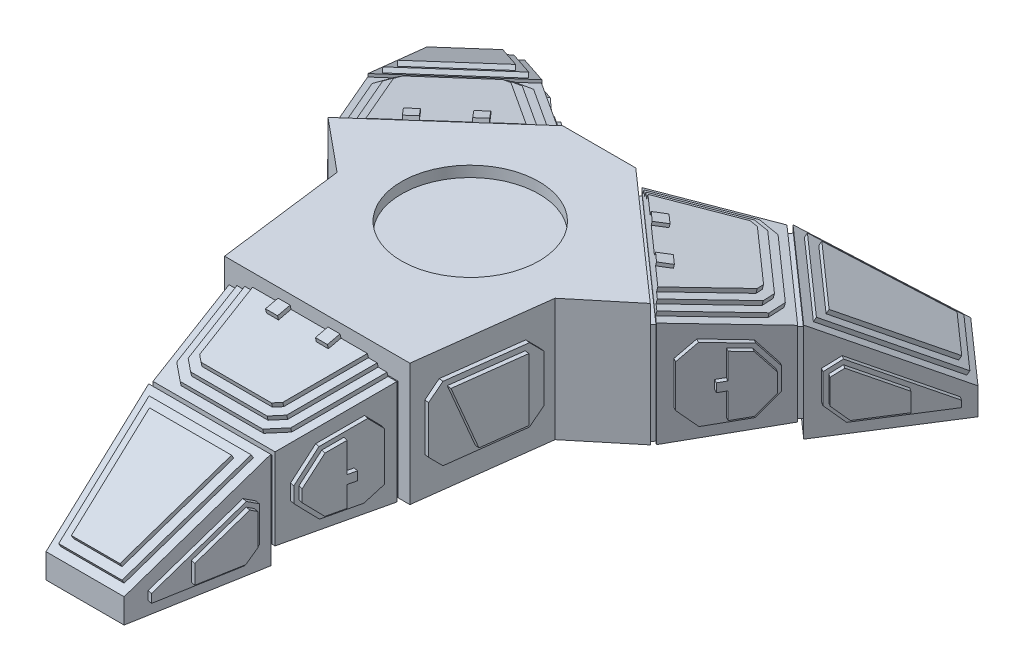
from build123d import *

# Parameters (mm, degrees)
BOSS_EXTRUDE1_DEPTH  = 14.25
SKETCH2_W            = 9.869565192
SKETCH2_H            = 12.25
BOSS_EXTRUDE2_DEPTH  = 12
DRAFT1_ANGLE         = 13
SKETCH3_W            = 6.724702797
SKETCH3_H            = 8.979581706
BOSS_EXTRUDE3_DEPTH  = 0.5
SKETCH4_W            = 7.099146898
SKETCH4_H            = 11.229581706
BOSS_EXTRUDE4_DEPTH  = 14.5
DRAFT2_ANGLE         = -30
DRAFT3_ANGLE         = -10
SKETCH5_W            = 0.5
SKETCH5_H            = 0.5
CUT_EXTRUDE1_DEPTH   = 42.024977271
SKETCH6_W            = 0.5
SKETCH6_H            = 0.5
CUT_EXTRUDE2_DEPTH   = 41.374636347
SKETCH7_W            = 18.337726852
SKETCH7_H            = 11.75
BOSS_EXTRUDE5_DEPTH  = 0.5
SKETCH8_W            = 19.337726852
SKETCH8_H            = 12.25
BOSS_EXTRUDE6_DEPTH  = 11.8
DRAFT4_ANGLE         = -12
SKETCH9_W            = 13.321391997
SKETCH9_H            = 9.241832572
BOSS_EXTRUDE7_DEPTH  = 0.5
SKETCH10_W           = 14.321391997
SKETCH10_H           = 11.491832572
BOSS_EXTRUDE8_DEPTH  = 14.5
DRAFT5_ANGLE         = -30
DRAFT6_ANGLE         = -9
SIDEDETAILS_DEPTH    = 0.5
BOSS_EXTRUDE10_DEPTH = 0.5
BOSS_EXTRUDE11_DEPTH = 0.5
BOSS_EXTRUDE12_DEPTH = 0.5
BOSS_EXTRUDE13_DEPTH = 0.5
BOSS_EXTRUDE14_DEPTH = 0.5
BOSS_EXTRUDE19_DEPTH = 0.5
BOSS_EXTRUDE20_DEPTH = 0.5
BOSS_EXTRUDE21_DEPTH = 0.5
BOSS_EXTRUDE22_DEPTH = 0.5
TOPDETAILS_DEPTH     = 0.5
BOSS_EXTRUDE24_DEPTH = 0.5
BOSS_EXTRUDE25_DEPTH = 0.5
BOSS_EXTRUDE26_DEPTH = 0.5
BOSS_EXTRUDE27_DEPTH = 0.5
BOSS_EXTRUDE28_DEPTH = 0.5
BOSS_EXTRUDE29_DEPTH = 0.4
BOSS_EXTRUDE30_DEPTH = 0.5
BOSS_EXTRUDE31_DEPTH = 0.5
SKETCH40_W           = 1.4
SKETCH40_H           = 1.5
BOSS_EXTRUDE32_DEPTH = 0.5
BOSS_EXTRUDE33_DEPTH = 0.5
BOSS_EXTRUDE34_DEPTH = 0.5
SKETCH46_R           = 8
CUT_EXTRUDE4_DEPTH   = 1.25
BOSS_EXTRUDE36_DEPTH = 0.5
BOSS_EXTRUDE37_DEPTH = 0.5


# Read off the part's stored shape, not the designer's step: Mirror1
with BuildPart() as part:
    # Sketch1 → Boss-Extrude1 (new body)
    with BuildSketch(Plane(origin=(0, 0, 0), x_dir=(1, 0, 0), z_dir=(0, 1, 0))):
        Polygon((0, 0), (10.776618207, 0), (12.678283248, 14.989595033), (18.740564562, 19.994875304), (4.25, 32.8), (0, 32.8), align=None)
    extrude(amount=BOSS_EXTRUDE1_DEPTH)

    # Sketch2 → Boss-Extrude2 (add)
    with BuildSketch(Plane.XY):
        with Locations((4.934782596, 6.125)):
            Rectangle(SKETCH2_W, SKETCH2_H)
    extrude(amount=BOSS_EXTRUDE2_DEPTH)

    # Draft1
    draft1_faces = [part.faces().sort_by_distance(p)[0] for p in [
        (9.869565192, 6.125, 6),
        (4.934782596, 12.25, 6),
    ]]
    draft(draft1_faces, Plane(origin=(0, 14.25, 0), x_dir=(1, 0, 0), z_dir=(0, 0, 1)), DRAFT1_ANGLE)

    # Sketch3 → Boss-Extrude3 (add)
    with BuildSketch(Plane.XY.offset(12)):
        with Locations((3.362351399, 4.489790853)):
            Rectangle(SKETCH3_W, SKETCH3_H)
    extrude(amount=BOSS_EXTRUDE3_DEPTH)

    # Sketch4 → Boss-Extrude4 (add)
    with BuildSketch(Plane.XY.offset(12.5)):
        with Locations((3.549573449, 3.864790853)):
            Rectangle(SKETCH4_W, SKETCH4_H)
    extrude(amount=BOSS_EXTRUDE4_DEPTH)

    # Draft2
    draft2_faces = [part.faces().sort_by_distance(p)[0] for p in [
        (3.549573449, 9.479581706, 19.75),
    ]]
    draft(draft2_faces, Plane(origin=(0, 0, 12.5), x_dir=(-1, 0, 0), z_dir=(0, 0, -1)), DRAFT2_ANGLE)

    # Draft3
    draft3_faces = [part.faces().sort_by_distance(p)[0] for p in [
        (7.099146898, 2.186465266, 18.313890377),
    ]]
    draft(draft3_faces, Plane(origin=(0, 0, 12.5), x_dir=(-1, 0, 0), z_dir=(0, 0, -1)), DRAFT3_ANGLE)

    # Sketch5 → Cut-Extrude1 (cut, through all)
    with BuildSketch(Plane(origin=(0, 14.25, 0), x_dir=(1, 0, 0), z_dir=(0, 1, 0))):
        with Locations((9.619565192, -0.25)):
            Rectangle(SKETCH5_W, SKETCH5_H)
    extrude(amount=-CUT_EXTRUDE1_DEPTH, mode=Mode.SUBTRACT)

    # Sketch6 → Cut-Extrude2 (cut, through all)
    with BuildSketch(Plane.ZY):
        with Locations((0.25, 12)):
            Rectangle(SKETCH6_W, SKETCH6_H)
    extrude(amount=-CUT_EXTRUDE2_DEPTH, mode=Mode.SUBTRACT)

    # Sketch7 → Boss-Extrude5 (add)
    with BuildSketch(Plane(origin=(18.138986789, 0, -20.526481811), x_dir=(-0.7493416714874174, 0, -0.6621835541392156), z_dir=(0.6621835541392156, 0, -0.7493416714874174))):
        with Locations((8.866055046, 5.875)):
            Rectangle(SKETCH7_W, SKETCH7_H)
    extrude(amount=BOSS_EXTRUDE5_DEPTH)

    # Sketch8 → Boss-Extrude6 (add)
    with BuildSketch(Plane(origin=(18.470078566, 0, -20.901152646), x_dir=(-0.7493416714874174, 0, -0.6621835541392156), z_dir=(0.6621835541392156, 0, -0.7493416714874174))):
        with Locations((8.866055046, 6.125)):
            Rectangle(SKETCH8_W, SKETCH8_H)
    extrude(amount=BOSS_EXTRUDE6_DEPTH)

    # Draft4
    draft4_faces = [part.faces().sort_by_distance(p)[0] for p in [
        (8.487974746, 6.125, -37.595786698),
        (15.733257028, 12.25, -31.19322435),
        (22.978539309, 6.125, -24.790662001),
    ]]
    draft(draft4_faces, Plane(origin=(18.470078566, 0, -20.901152646), x_dir=(0.7493416714874174, 0, 0.6621835541392156), z_dir=(-0.6621835541392156, 0, 0.7493416714874174)), DRAFT4_ANGLE)

    # Sketch9 → Boss-Extrude7 (add)
    with BuildSketch(Plane(origin=(26.283844505, 0, -29.74338437), x_dir=(-0.7493416714874174, 0, -0.6621835541392157), z_dir=(0.6621835541392157, 0, -0.7493416714874174))):
        with Locations((8.866055046, 4.620916286)):
            Rectangle(SKETCH9_W, SKETCH9_H)
    extrude(amount=BOSS_EXTRUDE7_DEPTH)

    # Sketch10 → Boss-Extrude8 (add)
    with BuildSketch(Plane(origin=(26.614936282, 0, -30.118055206), x_dir=(-0.7493416714874173, 0, -0.6621835541392158), z_dir=(0.6621835541392158, 0, -0.7493416714874173))):
        with Locations((8.866055046, 3.995916286)):
            Rectangle(SKETCH10_W, SKETCH10_H)
    extrude(amount=BOSS_EXTRUDE8_DEPTH)

    # Draft5
    draft5_faces = [part.faces().sort_by_distance(p)[0] for p in [
        (24.772062542, 9.741832572, -41.421738165),
    ]]
    draft(draft5_faces, Plane(origin=(26.614936282, 0, -30.118055206), x_dir=(0.7493416714874171, 0, 0.6621835541392158), z_dir=(-0.6621835541392158, 0, 0.7493416714874171)), DRAFT5_ANGLE)

    # Draft6
    draft6_faces = [part.faces().sort_by_distance(p)[0] for p in [
        (18.48942152, 2.302709714, -45.125924502),
        (29.221037337, 2.302709714, -35.642534249),
    ]]
    draft(draft6_faces, Plane(origin=(26.614936282, 0, -30.118055206), x_dir=(0.7493416714874171, 0, 0.6621835541392158), z_dir=(-0.6621835541392158, 0, 0.7493416714874171)), DRAFT6_ANGLE)

    # Sketch11 → SideDetails (add)
    with BuildSketch(Plane(origin=(10.605917047, 0, 1.34552679), x_dir=(0.12585688758415473, 0, -0.992048408016277), z_dir=(0.992048408016277, 0, 0.12585688758415473))):
        Polygon((4.411182393, 11.375), (2.911182393, 9.875), (2.911182393, 4.375), (4.411182393, 2.875), (13.411182393, 2.875), (14.911182393, 4.375), (14.911182393, 9.875), (13.411182393, 11.375), align=None)
    extrude(amount=SIDEDETAILS_DEPTH)

    # Sketch12 → Boss-Extrude10 (add)
    with BuildSketch(Plane(origin=(11.101941251, 0, 1.408455233), x_dir=(0.12585688758415464, 0, -0.992048408016277), z_dir=(0.992048408016277, 0, 0.12585688758415464))):
        Polygon((4.856311626, 10.75), (7.766053159, 3.5), (12.966053159, 3.5), (12.966053159, 10.75), align=None)
    extrude(amount=BOSS_EXTRUDE10_DEPTH)

    # Sketch13 → Boss-Extrude11 (add)
    with BuildSketch(Plane(origin=(9.370135813, 0, 2.163266306), x_dir=(0.22495105434386303, 0, -0.9743700647852358), z_dir=(0.9743700647852358, 0, 0.22495105434386303))):
        Polygon((-6.156430244, 8.828191261), (-8.595480198, 5.779524403), (-8.595480198, 4), (-6.095480198, 1.5), (-1.792982958, 1.5), (0.207017042, 2.654700538), (0.207017042, 8.259655438), (-1.425701256, 9.892373735), align=None)
    extrude(amount=BOSS_EXTRUDE11_DEPTH)

    # Sketch14 → Boss-Extrude12 (add)
    with BuildSketch(Plane(origin=(9.857320845, 0, 2.275741833), x_dir=(0.22495105434386298, 0, -0.9743700647852358), z_dir=(0.9743700647852358, 0, 0.22495105434386298))):
        Polygon((-3.730075326, 5.405617057), (-3.730075326, 8.86150773), (-5.875575986, 8.378875094), (-8.095480198, 5.604127333), (-8.095480198, 4.905617057), (-2.730075326, 4.905617057), (-2.730075326, 5.405617057), align=None)
        Polygon((-2.730075326, 4.905617057), (-8.095480198, 4.905617057), (-8.095480198, 4.207106781), (-5.888373417, 2), (-3.730075326, 2), (-3.730075326, 4.405617057), (-2.730075326, 4.405617057), align=None)
    extrude(amount=BOSS_EXTRUDE12_DEPTH)

    # Sketch15 → Boss-Extrude13 (add)
    with BuildSketch(Plane(origin=(9.022707322, 0, 1.59094674), x_dir=(0.17364817766693072, 0, -0.9848077530122081), z_dir=(0.9848077530122081, 0, 0.17364817766693072))):
        Polygon((-12.577342991, 5.401203182), (-13.881305304, 6.159797567), (-23.395897584, 0.75), (-23.395897584, -0.25), (-14.077342991, -0.25), (-12.577342991, 1.25), align=None)
    extrude(amount=BOSS_EXTRUDE13_DEPTH)

    # Sketch16 → Boss-Extrude14 (add)
    with BuildSketch(Plane(origin=(9.515111198, 0, 1.677770829), x_dir=(0.17364817766693083, 0, -0.984807753012208), z_dir=(0.984807753012208, 0, 0.17364817766693083))):
        Polygon((-13.884161938, 5.583003347), (-19.395897584, 2.449146088), (-19.395897584, 0.25), (-14.284449772, 0.25), (-13.077342991, 1.457106781), (-13.077342991, 5.113627571), align=None)
    extrude(amount=BOSS_EXTRUDE14_DEPTH)

    # Sketch26 → Boss-Extrude19 (add)
    with BuildSketch(Plane(origin=(5.732728558, 0, 3.239013829), x_dir=(0.49191636080750245, 0, -0.8706424604680747), z_dir=(0.8706424604680747, 0, 0.49191636080750245))):
        Polygon((30.574377081, 9.998937808), (28.616251551, 8.406054998), (28.616251551, 3.5), (30.616251551, 1.5), (35.42987057, 1.5), (37.67987057, 3.75), (37.67987057, 6.271622643), (35.476979348, 8.979629482), align=None)
    boss_extrude19 = extrude(amount=BOSS_EXTRUDE19_DEPTH)

    # Sketch27 → Boss-Extrude20 (add)
    with BuildSketch(Plane(origin=(6.168049788, 0, 3.484972009), x_dir=(0.49191636080750223, 0, -0.8706424604680749), z_dir=(0.8706424604680749, 0, 0.49191636080750223))):
        Polygon((35.201234998, 8.526267467), (32.955424387, 8.993197749), (32.955424387, 5.996598874), (31.955424387, 5.996598874), (31.955424387, 4.996598874), (32.955424387, 4.996598874), (32.955424387, 2), (35.222763789, 2), (37.17987057, 3.957106781), (37.17987057, 6.093937351), align=None)
    boss_extrude20 = extrude(amount=BOSS_EXTRUDE20_DEPTH)

    # Sketch28 → Boss-Extrude21 (add)
    with BuildSketch(Plane(origin=(3.883704679, 0, 2.47101268), x_dir=(0.5368081122456657, 0, -0.8437043621004011), z_dir=(0.8437043621004011, 0, 0.5368081122456657))):
        Polygon((43.201998719, 6.169001405), (41.464625188, 5.159724987), (41.464625188, 1.75), (43.464625188, -0.25), (53.145369512, -0.25), (53.145369512, 0.498872472), align=None)
    boss_extrude21 = extrude(amount=BOSS_EXTRUDE21_DEPTH)

    # Sketch29 → Boss-Extrude22 (add)
    with BuildSketch(Plane(origin=(4.30555686, 0, 2.739416736), x_dir=(0.5368081122456659, 0, -0.843704362100401), z_dir=(0.843704362100401, 0, 0.5368081122456659))):
        Polygon((48.772439215, 0.25), (48.772439215, 2.416920091), (43.20431247, 5.592100543), (41.964625188, 4.871940418), (41.964625188, 1.957106781), (43.671731969, 0.25), align=None)
    boss_extrude22 = extrude(amount=BOSS_EXTRUDE22_DEPTH)

    # Sketch30 → TopDetails (add)
    with BuildSketch(Plane(origin=(9.447047619, 24.710318393, -10.690489682), x_dir=(0.943546922574932, -0.2997023380247018, 0.1410592552153272), z_dir=(0.3310917770696084, 0.8660254037844383, -0.37467083574370935))):
        Polygon((6.632948442, 33.68265489), (16.260983286, 26.472814318), (23.479403207, 39.486060982), (17.088763979, 44.27161595), align=None)
    extrude(amount=TOPDETAILS_DEPTH)

    # Sketch31 → Boss-Extrude24 (add)
    with BuildSketch(Plane(origin=(9.612593507, 25.143331095, -10.8778251), x_dir=(0.943546922574932, -0.2997023380247016, 0.14105925521532697), z_dir=(0.3310917770696081, 0.866025403784438, -0.3746708357437097))):
        Polygon((17.187507093, 42.948370048), (8.150087218, 33.795866658), (15.942653862, 27.960494845), (22.18185074, 39.20841459), align=None)
    extrude(amount=BOSS_EXTRUDE24_DEPTH)

    # Sketch33 → Boss-Extrude25 (add)
    with BuildSketch(Plane(origin=(2.44808378, 17.392954852, -2.770306179), x_dir=(0.9904756153237979, -0.1356663889180455, 0.023509282568419283), z_dir=(0.13767570237279786, 0.9781476007338056, -0.15579689391915552))):
        Polygon((15.975246815, 18.8870633), (16.470216424, 19.780501802), (20.724492523, 27.459627951), (20.314743823, 29.750505442), (12.968563425, 36.07631809), (10.642242704, 36.141476199), (3.679679746, 30.794462024), (2.869610774, 30.172356299), align=None)
    extrude(amount=BOSS_EXTRUDE25_DEPTH)

    # Sketch34 → Boss-Extrude26 (add)
    with BuildSketch(Plane(origin=(2.516921631, 17.882028653, -2.848204626), x_dir=(0.9904756153237978, -0.13566638891804614, 0.023509282568419398), z_dir=(0.13767570237279853, 0.9781476007338055, -0.15579689391915558))):
        Polygon((4.453656799, 30.127988624), (3.643587827, 29.505882899), (15.201269762, 19.5535367), (15.696239371, 20.446975202), (19.677545323, 27.633380112), (19.392934615, 29.22461949), (12.585334053, 35.086659815), (10.969475872, 35.13191852), align=None)
    extrude(amount=BOSS_EXTRUDE26_DEPTH)

    # Sketch35 → Boss-Extrude27 (add)
    with BuildSketch(Plane(origin=(0, 11.630113534, 2.685023274), x_dir=(1, 0, 0), z_dir=(0, 0.9743700647852351, 0.22495105434386561))):
        Polygon((1, -8.559998878), (0, -8.559998878), (0, 2.242498362), (8.729141839, 2.242498362), (8.504190785, 1.242498362), (6.628308811, -7.096568905), (4.799108696, -8.559998878), align=None)
    extrude(amount=BOSS_EXTRUDE27_DEPTH)

    # Sketch36 → Boss-Extrude28 (add)
    with BuildSketch(Plane(origin=(2.585759482, 18.371102453, -2.926103073), x_dir=(0.9904756153237978, -0.1356663889180453, 0.02350928256841947), z_dir=(0.13767570237279772, 0.9781476007338057, -0.15579689391915463))):
        Polygon((5.227633851, 29.461515223), (4.41756488, 28.839409499), (14.42729271, 20.2200101), (14.922262319, 21.113448602), (18.630598124, 27.807132273), (18.471125407, 28.698733537), (12.202104681, 34.097001541), (11.296709039, 34.122360842), align=None)
    extrude(amount=BOSS_EXTRUDE28_DEPTH)

    # Sketch37 → Boss-Extrude29 (add)
    with BuildSketch(Plane(origin=(2.654597333, 18.860176253, -3.00400152), x_dir=(0.990475615323798, -0.13566638891804428, 0.02350928256841908), z_dir=(0.1376757023727966, 0.978147600733806, -0.15579689391915347))):
        Polygon((7.673228122, 28.015437414), (6.694449186, 26.878779244), (7.755330145, 25.965252238), (8.73410908, 27.101910408), align=None)
        Polygon((13.129187338, 23.317298525), (12.150408403, 22.180640355), (11.089527444, 23.094167361), (12.06830638, 24.230825531), align=None)
    extrude(amount=BOSS_EXTRUDE29_DEPTH)

    # Sketch38 → Boss-Extrude30 (add)
    with BuildSketch(Plane(origin=(0, 12.117298566, 2.797498801), x_dir=(1, 0, 0), z_dir=(0, 0.9743700647852351, 0.2249510543438655))):
        Polygon((1, -7.559998878), (0, -7.559998878), (0, 2.242498362), (7.704152582, 2.242498362), (7.479201528, 1.242498362), (5.729676477, -6.53486039), (4.448314556, -7.559998878), align=None)
    extrude(amount=BOSS_EXTRUDE30_DEPTH)

    # Sketch39 → Boss-Extrude31 (add)
    with BuildSketch(Plane(origin=(0, 12.604483598, 2.909974328), x_dir=(1, 0, 0), z_dir=(0, 0.9743700647852352, 0.22495105434386536))):
        Polygon((1, -6.559998878), (0, -6.559998878), (0, 2.242498362), (6.679163325, 2.242498362), (6.454212271, 1.242498362), (4.831044143, -5.973151875), (4.097520417, -6.559998878), align=None)
    extrude(amount=BOSS_EXTRUDE31_DEPTH)

    # Sketch40 → Boss-Extrude32 (add)
    with BuildSketch(Plane(origin=(0, 13.091668631, 3.022449856), x_dir=(1, 0, 0), z_dir=(0, 0.9743700647852352, 0.22495105434386545))):
        with Locations((2.9, 1.492498362)):
            Rectangle(SKETCH40_W, SKETCH40_H)
    extrude(amount=BOSS_EXTRUDE32_DEPTH)

    # Sketch41 → Boss-Extrude33 (add)
    with BuildSketch(Plane(origin=(0, 12.522345054, 7.229779288), x_dir=(1, 0, 0), z_dir=(0, 0.8660254037844382, 0.500000000000001))):
        Polygon((1, -21.828684501), (0, -21.828684501), (0, -7.085526694), (5.934851239, -7.085526694), (3.683517308, -21.828684501), align=None)
    extrude(amount=BOSS_EXTRUDE33_DEPTH)

    # Mirror2: Boss-Extrude19, Boss-Extrude20, Boss-Extrude21, Boss-Extrude22 across plane
    add(boss_extrude19.mirror(Plane(origin=(-6.643704508, 0, -5.870955841), x_dir=(-0.6621835541392167, 2.5373469794802872e-15, 0.7493416714874163), z_dir=(-0.7493416714874163, 2.8713184053912184e-15, -0.6621835541392168))))
    add(boss_extrude20.mirror(Plane(origin=(-6.643704508, 0, -5.870955841), x_dir=(-0.6621835541392167, 2.5373469794802872e-15, 0.7493416714874163), z_dir=(-0.7493416714874163, 2.8713184053912184e-15, -0.6621835541392168))))
    add(boss_extrude21.mirror(Plane(origin=(-6.643704508, 0, -5.870955841), x_dir=(-0.6621835541392167, 2.5373469794802872e-15, 0.7493416714874163), z_dir=(-0.7493416714874163, 2.8713184053912184e-15, -0.6621835541392168))))
    add(boss_extrude22.mirror(Plane(origin=(-6.643704508, 0, -5.870955841), x_dir=(-0.6621835541392167, 2.5373469794802872e-15, 0.7493416714874163), z_dir=(-0.7493416714874163, 2.8713184053912184e-15, -0.6621835541392168))))

    # Sketch42 → Boss-Extrude34 (add)
    with BuildSketch(Plane(origin=(0, 12.955357755, 7.479779288), x_dir=(1, 0, 0), z_dir=(0, 0.866025403784438, 0.5000000000000012))):
        Polygon((1, -20.828684501), (0, -20.828684501), (0, -8.085526694), (4.770555581, -8.085526694), (2.824628939, -20.828684501), align=None)
    extrude(amount=BOSS_EXTRUDE34_DEPTH)

    # Mirror1: part across plane


with BuildPart() as part_1:
    add(part.part)
    add(part.part.mirror(Plane(origin=(0, 0, 0), x_dir=(0, 0, 1), z_dir=(1, 0, 0))))

    # Sketch46 → Cut-Extrude4 (cut)
    with BuildSketch(Plane(origin=(0, 14.25, 0), x_dir=(1, 0, 0), z_dir=(0, 1, 0))):
        with Locations(Location((0, 17.8, 0), (0, 0, 270))):
            Circle(SKETCH46_R)
    extrude(amount=-CUT_EXTRUDE4_DEPTH, mode=Mode.SUBTRACT)

    # Sketch47 → Boss-Extrude36 (add)
    with BuildSketch(Plane(origin=(0, 0, -32.8), x_dir=(-1, 0, 0), z_dir=(0, 0, -1))):
        Polygon((3.25, 12.25), (2.25, 13.25), (-2.25, 13.25), (-3.25, 12.25), (-3.25, 2), (-2.25, 1), (2.25, 1), (3.25, 2), align=None)
    extrude(amount=BOSS_EXTRUDE36_DEPTH)

    # Sketch48 → Boss-Extrude37 (add)
    with BuildSketch(Plane(origin=(0, 0, -33.3), x_dir=(-1, 0, 0), z_dir=(0, 0, -1))):
        Polygon((2.75, 2.207106781), (2.75, 12.042893219), (2.042893219, 12.75), (-2.042893219, 12.75), (-2.75, 12.042893219), (-2.75, 2.207106781), (-2.042893219, 1.5), (2.042893219, 1.5), align=None)
    extrude(amount=BOSS_EXTRUDE37_DEPTH)


solid = part_1.part
